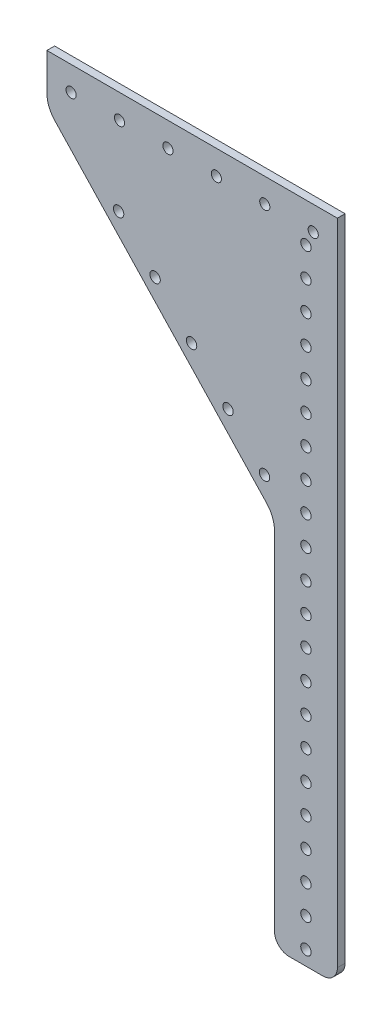
from build123d import *

# Parameters (mm, degrees)
SKETCH1_R           = 2.15
SKETCH1_R_2         = 2.1
BOSS_EXTRUDE1_DEPTH = 3.175
FILLET2_R           = 12
FILLET3_R           = 6


with BuildPart() as part:
    # Sketch1 → Boss-Extrude1 (new body)
    with BuildSketch(Plane.XY):
        Polygon((26, 274.1), (26, 0), (0, 0), (0, 154.1), (-94, 254.1), (-94, 274.1), align=None)
        with Locations((13, 6)):
            Circle(SKETCH1_R, mode=Mode.SUBTRACT)
        with Locations((13, 18)):
            Circle(SKETCH1_R, mode=Mode.SUBTRACT)
        with Locations((13, 30)):
            Circle(SKETCH1_R, mode=Mode.SUBTRACT)
        with Locations((13, 42)):
            Circle(SKETCH1_R, mode=Mode.SUBTRACT)
        with Locations((13, 54)):
            Circle(SKETCH1_R, mode=Mode.SUBTRACT)
        with Locations((13, 66)):
            Circle(SKETCH1_R, mode=Mode.SUBTRACT)
        with Locations((13, 78)):
            Circle(SKETCH1_R, mode=Mode.SUBTRACT)
        with Locations((13, 90)):
            Circle(SKETCH1_R, mode=Mode.SUBTRACT)
        with Locations((13, 102)):
            Circle(SKETCH1_R, mode=Mode.SUBTRACT)
        with Locations((13, 114)):
            Circle(SKETCH1_R, mode=Mode.SUBTRACT)
        with Locations((13, 126)):
            Circle(SKETCH1_R, mode=Mode.SUBTRACT)
        with Locations((13, 138)):
            Circle(SKETCH1_R, mode=Mode.SUBTRACT)
        with Locations((13, 150)):
            Circle(SKETCH1_R, mode=Mode.SUBTRACT)
        with Locations((13, 162)):
            Circle(SKETCH1_R, mode=Mode.SUBTRACT)
        with Locations((13, 174)):
            Circle(SKETCH1_R, mode=Mode.SUBTRACT)
        with Locations((13, 186)):
            Circle(SKETCH1_R, mode=Mode.SUBTRACT)
        with Locations((13, 198)):
            Circle(SKETCH1_R, mode=Mode.SUBTRACT)
        with Locations((13, 210)):
            Circle(SKETCH1_R, mode=Mode.SUBTRACT)
        with Locations((16, 264.1)):
            Circle(SKETCH1_R_2, mode=Mode.SUBTRACT)
        with Locations((-4, 264.1)):
            Circle(SKETCH1_R_2, mode=Mode.SUBTRACT)
        with Locations((-24, 264.1)):
            Circle(SKETCH1_R_2, mode=Mode.SUBTRACT)
        with Locations((-44, 264.1)):
            Circle(SKETCH1_R_2, mode=Mode.SUBTRACT)
        with Locations((-64, 264.1)):
            Circle(SKETCH1_R_2, mode=Mode.SUBTRACT)
        with Locations((-4.109460053, 167.232040974)):
            Circle(SKETCH1_R, mode=Mode.SUBTRACT)
        with Locations((-19.177480246, 183.26184969)):
            Circle(SKETCH1_R, mode=Mode.SUBTRACT)
        with Locations((-34.245500438, 199.291658406)):
            Circle(SKETCH1_R, mode=Mode.SUBTRACT)
        with Locations((-49.313520631, 215.321467121)):
            Circle(SKETCH1_R, mode=Mode.SUBTRACT)
        with Locations((-64.381540824, 231.351275837)):
            Circle(SKETCH1_R, mode=Mode.SUBTRACT)
        with Locations((13, 222)):
            Circle(SKETCH1_R, mode=Mode.SUBTRACT)
        with Locations((13, 234)):
            Circle(SKETCH1_R, mode=Mode.SUBTRACT)
        with Locations((13, 246)):
            Circle(SKETCH1_R, mode=Mode.SUBTRACT)
        with Locations((13, 258)):
            Circle(SKETCH1_R, mode=Mode.SUBTRACT)
        with Locations((-84, 264.1)):
            Circle(SKETCH1_R_2, mode=Mode.SUBTRACT)
    extrude(amount=BOSS_EXTRUDE1_DEPTH)

    # Fillet2
    fillet2_edges = [part.edges().sort_by_distance(p)[0] for p in [
        (0, 154.1, 1.5875),
        (-94, 254.1, 1.5875),
    ]]
    fillet(fillet2_edges, radius=FILLET2_R)

    # Fillet3
    fillet3_edges = [part.edges().sort_by_distance(p)[0] for p in [
        (26, 0, 1.5875),
        (0, 0, 1.5875),
    ]]
    fillet(fillet3_edges, radius=FILLET3_R)


solid = part.part
